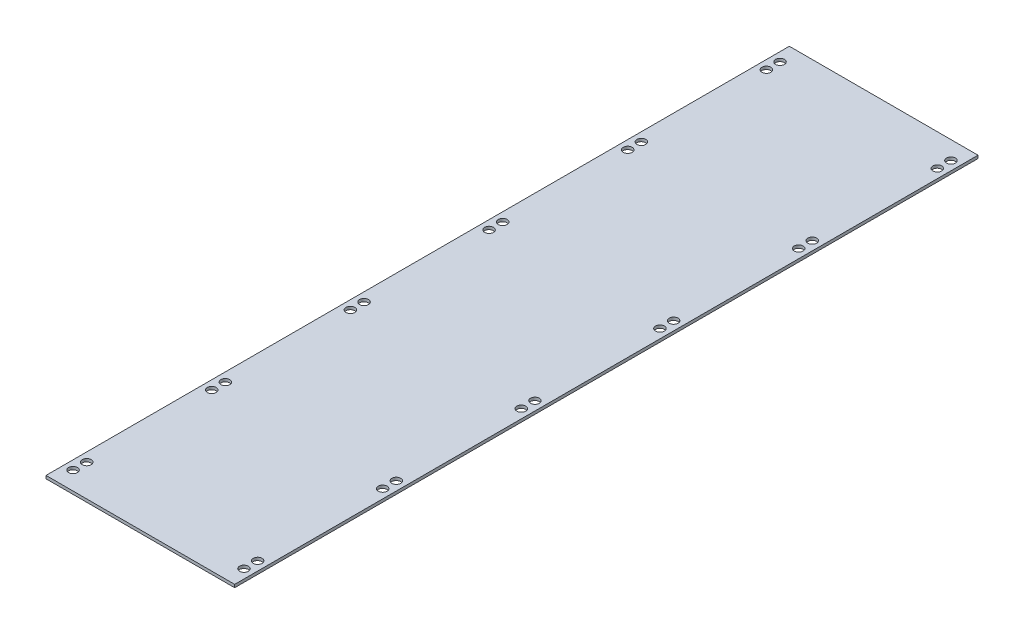
from build123d import *

# Parameters (mm, degrees)
SKETCH1_W           = 83
SKETCH1_H           = 327
BOSS_EXTRUDE1_DEPTH = 1.3
SKETCH2_R           = 1.95
CUT_EXTRUDE1_DEPTH  = 10


with BuildPart() as part:
    # Sketch1 → Boss-Extrude1 (new body)
    with BuildSketch(Plane(origin=(0, 0, 0), x_dir=(1, 0, 0), z_dir=(0, 1, 0))):
        with Locations((41.5, 163.5)):
            Rectangle(SKETCH1_W, SKETCH1_H)
    extrude(amount=BOSS_EXTRUDE1_DEPTH)

    # Sketch2 → Cut-Extrude1 (cut)
    with BuildSketch(Plane(origin=(0, 1.3, 0), x_dir=(1, 0, 0), z_dir=(0, 1, 0))):
        with Locations((3.9, 319)):
            Circle(SKETCH2_R)
        with Locations((3.9, 313)):
            Circle(SKETCH2_R)
        with Locations((79.1, 319)):
            Circle(SKETCH2_R)
        with Locations((79.1, 313)):
            Circle(SKETCH2_R)
        with Locations((79.1, 258)):
            Circle(SKETCH2_R)
        with Locations((79.1, 252)):
            Circle(SKETCH2_R)
        with Locations((79.1, 197)):
            Circle(SKETCH2_R)
        with Locations((79.1, 191)):
            Circle(SKETCH2_R)
        with Locations((79.1, 136)):
            Circle(SKETCH2_R)
        with Locations((79.1, 130)):
            Circle(SKETCH2_R)
        with Locations((79.1, 75)):
            Circle(SKETCH2_R)
        with Locations((79.1, 69)):
            Circle(SKETCH2_R)
        with Locations((79.1, 14)):
            Circle(SKETCH2_R)
        with Locations((79.1, 8)):
            Circle(SKETCH2_R)
        with Locations((3.9, 258)):
            Circle(SKETCH2_R)
        with Locations((3.9, 252)):
            Circle(SKETCH2_R)
        with Locations((3.9, 197)):
            Circle(SKETCH2_R)
        with Locations((3.9, 191)):
            Circle(SKETCH2_R)
        with Locations((3.9, 136)):
            Circle(SKETCH2_R)
        with Locations((3.9, 130)):
            Circle(SKETCH2_R)
        with Locations((3.9, 75)):
            Circle(SKETCH2_R)
        with Locations((3.9, 69)):
            Circle(SKETCH2_R)
        with Locations((3.9, 14)):
            Circle(SKETCH2_R)
        with Locations((3.9, 8)):
            Circle(SKETCH2_R)
    extrude(amount=-CUT_EXTRUDE1_DEPTH, mode=Mode.SUBTRACT)


solid = part.part
